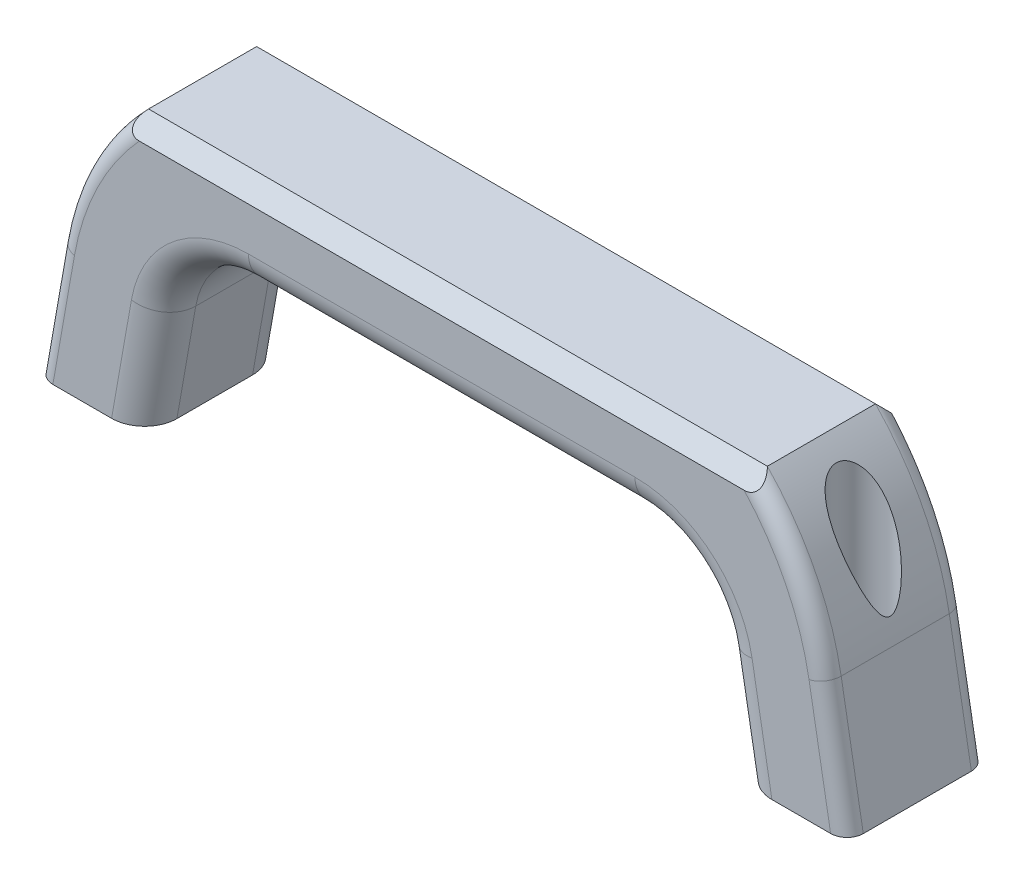
from build123d import *
from build123d.topology import SkipClean

# Parameters (mm, degrees)
BOSS_EXTRUDE1_DEPTH = 13
FILLET1_R           = 6
FILLET3_R           = 3
SKETCH6_R           = 3
CUT_EXTRUDE3_DEPTH  = 92.071400629
CUT_EXTRUDE4_START  = -15
SKETCH7_R           = 5
CUT_EXTRUDE4_DEPTH  = 77.071400629
CUT_EXTRUDE5_START  = -1
CUT_EXTRUDE5_DEPTH  = 1
CUT_EXTRUDE1_DEPTH  = 92.071400629


with BuildPart() as part:
    # Sketch2 → Boss-Extrude1 (new, symmetric)
    with BuildSketch(Plane.XY):
        with BuildLine():
            Line((-55, 0), (-51.512539586, 19.778370843))
            ThreePointArc((-51.512539586, 19.778370843), (-46.040217293, 29.25671109), (-35.755615538, 33))
            Line((-35.755615538, 33), (0, 33))
            Line((0, 33), (0, 50))
            Line((0, 50), (-57.253456286, 50))
            ThreePointArc((-57.253456286, 50), (-66.084211145, 37.619738286), (-70.909465794, 23.198572276))
            Line((-70.909465794, 23.198572276), (-75, 0))
            Line((-75, 0), (-55, 0))
        make_face()
    extrude(amount=BOSS_EXTRUDE1_DEPTH, both=True)

    # Fillet1
    fillet1_edges = [part.edges().sort_by_distance(p)[0] for p in [
        (-17.877807769, 33, -13),
        (-46.040217293, 29.25671109, -13),
        (-17.877807769, 33, 13),
        (-46.040217293, 29.25671109, 13),
        (-53.256269793, 9.889185421, -13),
        (-53.256269793, 9.889185421, 13),
    ]]
    fillet(fillet1_edges, radius=FILLET1_R)

    # Fillet3
    fillet3_edges = [part.edges().sort_by_distance(p)[0] for p in [
        (-72.954732897, 11.599286138, -13),
        (-72.954732897, 11.599286138, 13),
        (-66.084211145, 37.619738286, -13),
        (-66.084211145, 37.619738286, 13),
    ]]
    fillet(fillet3_edges, radius=FILLET3_R)

    # Sketch6 → Cut-Extrude3 (cut, through all)
    with BuildSketch(Plane.XZ):
        with Locations((-65, 0)):
            Circle(SKETCH6_R)
    extrude(amount=-CUT_EXTRUDE3_DEPTH, mode=Mode.SUBTRACT)

    # Sketch7 → Cut-Extrude4 (cut, through all)
    with BuildSketch(Plane.XZ.offset(CUT_EXTRUDE4_START)):
        with Locations((-65, 0)):
            Circle(SKETCH7_R)
    extrude(amount=-CUT_EXTRUDE4_DEPTH, mode=Mode.SUBTRACT)

    # Sketch8 → Cut-Extrude5 (cut)
    with SkipClean():  # the faces are left unmerged after this step: merging them gives an invalid solid
        with BuildSketch(Plane(origin=(0, 15, 0), x_dir=(1, 0, 0), z_dir=(0, 1, 0)).offset(CUT_EXTRUDE5_START)):
            with BuildLine():
                Line((-68, 4), (-68, -4))
                ThreePointArc((-68, -4), (-65, -5), (-62, -4))
                Line((-62, -4), (-62, 4))
                ThreePointArc((-62, 4), (-65, 5), (-68, 4))
            make_face()
        extrude(amount=CUT_EXTRUDE5_DEPTH, mode=Mode.SUBTRACT)

    # Mirror2: part across plane


with BuildPart() as part_1:
    with SkipClean():  # the faces are left unmerged after this step: merging them gives an invalid solid
        add(part.part)
        add(part.part.mirror(Plane(origin=(0, 50, 13), x_dir=(0, 0, 1), z_dir=(1, 0, 0))))

    # Sketch3 → Cut-Extrude1 (cut, symmetric)
    with SkipClean():  # the faces are left unmerged after this step: merging them gives an invalid solid
        with BuildSketch(Plane(origin=(0, 0, 0), x_dir=(0, 0, -1), z_dir=(1, 0, 0))):
            Polygon((-10, 50), (-13, 47), (-13, 50), align=None)
        cut_extrude1 = extrude(amount=CUT_EXTRUDE1_DEPTH, both=True, mode=Mode.SUBTRACT)

    # Mirror3: Cut-Extrude1 across plane
    with SkipClean():  # the faces are left unmerged after this step: merging them gives an invalid solid
        add(cut_extrude1.mirror(Plane.XY), mode=Mode.SUBTRACT)


solid = part_1.part
